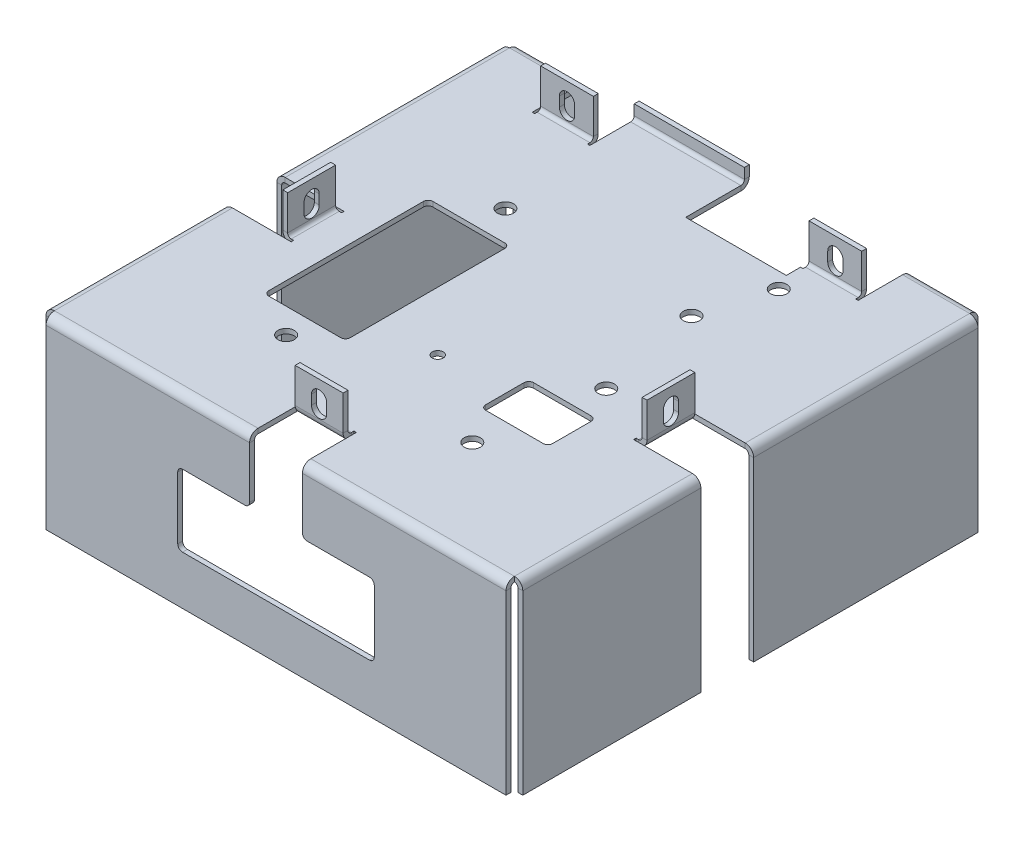
from build123d import *

# Parameters (mm, degrees)
SKETCH1_W                     = 96
SKETCH1_H                     = 96.75
BASE_FLANGE1_DEPTH            = 1.016
EDGE_FLANGE1_STRIP_W          = 12.5372
EDGE_FLANGE1_STRIP_H          = 1.016
EDGE_FLANGE1_STRIP_CUT_DEPTH  = 11
EDGE_FLANGE1_RELIEF_W         = 13.0452
EDGE_FLANGE1_RELIEF_H         = 0.508
EDGE_FLANGE1_RELIEF_CUT_DEPTH = 1.016
EDGE_FLANGE1_DEPTH            = 11
CUT_EXTRUDE4_REACH            = 104.093
EDGE_FLANGE8_STRIP_W          = 14.5372
EDGE_FLANGE8_STRIP_H          = 1.016
EDGE_FLANGE8_STRIP_CUT_DEPTH  = 10
EDGE_FLANGE8_RELIEF_W         = 15.0452
EDGE_FLANGE8_RELIEF_H         = 0.508
EDGE_FLANGE8_RELIEF_CUT_DEPTH = 1.016
EDGE_FLANGE8_DEPTH            = 10
EDGE_FLANGE2_STRIP_W          = 5.5372
EDGE_FLANGE2_STRIP_H          = 1.016
EDGE_FLANGE2_STRIP_CUT_DEPTH  = 42.492
EDGE_FLANGE2_DEPTH            = 42.492
EDGE_FLANGE9_STRIP_W          = 5.5372
EDGE_FLANGE9_STRIP_H          = 1.016
EDGE_FLANGE9_STRIP_CUT_DEPTH  = 42.492
EDGE_FLANGE9_DEPTH            = 42.492
EDGE_FLANGE4_STRIP_W          = 15.5372
EDGE_FLANGE4_STRIP_H          = 1.016
EDGE_FLANGE4_STRIP_CUT_DEPTH  = 10
EDGE_FLANGE4_RELIEF_W         = 16.0452
EDGE_FLANGE4_RELIEF_H         = 0.508
EDGE_FLANGE4_RELIEF_CUT_DEPTH = 1.016
EDGE_FLANGE4_DEPTH            = 10
CUT_EXTRUDE1_REACH            = 107.99
EDGE_FLANGE5_DEPTH            = 37.155701425
EDGE_FLANGE6_DEPTH            = 46.825698575
CUT_EXTRUDE2_REACH            = 110.042
EDGE_FLANGE10_DEPTH           = 13.992
SKETCH59_W                    = 20.992
SKETCH59_H                    = 12.25
CUT_EXTRUDE9_DEPTH            = 10
EDGE_FLANGE11_STRIP_W         = 5.5372
EDGE_FLANGE11_STRIP_H         = 1.016
EDGE_FLANGE11_STRIP_CUT_DEPTH = 22.992
EDGE_FLANGE11_DEPTH           = 22.992
CUT_EXTRUDE5_REACH            = 82.534
SKETCH54_W                    = 17
SKETCH54_H                    = 34.2448
CUT_EXTRUDE6_REACH            = 82.534
SKETCH55_W                    = 14
SKETCH55_H                    = 10
CUT_EXTRUDE7_REACH            = 82.534
SKETCH56_R                    = 1.7
CUT_EXTRUDE8_REACH            = 118.943
SKETCH57_W                    = 15
SKETCH57_H                    = 15
FILLET1_R                     = 1
CUT_EXTRUDE10_REACH           = 82.534
SKETCH60_R                    = 1.1303
BOSS_EXTRUDE1_REACH           = 86.049
SKETCH61_W                    = 1.016
SKETCH61_H                    = 10.18


# Sheet-metal steps are written as plain solids
with BuildPart() as part:
    # Sketch1 → Base-Flange1 (new body)
    with BuildSketch(Plane(origin=(0, 0, 0), x_dir=(1, 0, 0), z_dir=(0, 1, 0))):
        Rectangle(SKETCH1_W, SKETCH1_H)
    extrude(amount=-BASE_FLANGE1_DEPTH)

    # Edge-Flange1 strip (across the edge) → Edge-Flange1 strip cut (cut)
    with BuildSketch(Plane(origin=(33.5, 0, -41.375), x_dir=(0, 0, 1), z_dir=(-1, 0, 0))):
        with Locations((-4.516, -0.508)):
            Rectangle(EDGE_FLANGE1_STRIP_W, EDGE_FLANGE1_STRIP_H)
    edge_flange1_strip_cut = extrude(amount=EDGE_FLANGE1_STRIP_CUT_DEPTH, mode=Mode.SUBTRACT)

    # Edge-Flange1 relief (on the sheet) → Edge-Flange1 relief cut (cut)
    with BuildSketch(Plane(origin=(33.5, 0, -39.6224), x_dir=(0, 0, 1), z_dir=(0, 1, 0))):
        with Locations((-6.0146, 0.254)):
            Rectangle(EDGE_FLANGE1_RELIEF_W, EDGE_FLANGE1_RELIEF_H)
        with Locations((-6.0146, -11.254)):
            Rectangle(EDGE_FLANGE1_RELIEF_W, EDGE_FLANGE1_RELIEF_H)
    edge_flange1_relief_cut = extrude(amount=-EDGE_FLANGE1_RELIEF_CUT_DEPTH, mode=Mode.SUBTRACT)

    # Edge-Flange1 section (across the edge) → Edge-Flange1 (add)
    with BuildSketch(Plane(origin=(33.5, 0, -41.375), x_dir=(0, 0, 1), z_dir=(-1, 0, 0))):
        with BuildLine():
            Line((0, 0.7366), (0, 8))
            Line((0, 8), (1.016, 8))
            Line((1.016, 8), (1.016, 0.7366))
            ThreePointArc((1.016, 0.7366), (1.231745145, 0.215745145), (1.7526, 0))
            Line((1.7526, 0), (1.7526, -1.016))
            ThreePointArc((1.7526, -1.016), (0.513324655, -0.502675345), (0, 0.7366))
        make_face()
    edge_flange1 = extrude(amount=EDGE_FLANGE1_DEPTH)

    # Sketch47 → Cut-Extrude4 (cut, up to next)
    with BuildSketch(Plane(origin=(0, 0, -41.375), x_dir=(-1, 0, 0), z_dir=(0, 0, -1)), mode=Mode.PRIVATE) as cut_extrude4_sk1:
        with BuildLine():
            Line((-29.59, 4.5), (-29.59, 2.5))
            ThreePointArc((-29.59, 2.5), (-28, 0.91), (-26.41, 2.5))
            Line((-26.41, 2.5), (-26.41, 4.5))
            ThreePointArc((-26.41, 4.5), (-28, 6.09), (-29.59, 4.5))
        make_face()
    cut_extrude4_tool1 = extrude(cut_extrude4_sk1.sketch, amount=-CUT_EXTRUDE4_REACH, mode=Mode.PRIVATE) & part.part
    cut_extrude4 = cut_extrude4_tool1.solids().sort_by_distance((28, 3.5, -41.375))[0]
    add(cut_extrude4, mode=Mode.SUBTRACT)

    # Mirror4: Edge-Flange1 strip cut, Edge-Flange1 relief cut, Edge-Flange1, Cut-Extrude4 across plane
    add(edge_flange1_strip_cut.mirror(Plane(origin=(0, 0, 0), x_dir=(0, 0, 1), z_dir=(1, 0, 0))), mode=Mode.SUBTRACT)
    add(edge_flange1_relief_cut.mirror(Plane(origin=(0, 0, 0), x_dir=(0, 0, 1), z_dir=(1, 0, 0))), mode=Mode.SUBTRACT)
    add(edge_flange1.mirror(Plane(origin=(0, 0, 0), x_dir=(0, 0, 1), z_dir=(1, 0, 0))))
    add(cut_extrude4.mirror(Plane(origin=(0, 0, 0), x_dir=(0, 0, 1), z_dir=(1, 0, 0))), mode=Mode.SUBTRACT)

    # Edge-Flange8 strip (across the edge) → Edge-Flange8 strip cut (cut)
    with BuildSketch(Plane(origin=(-5, 0, 39.375), x_dir=(0, 0, -1), z_dir=(1, 0, 0))):
        with Locations((-5.516, -0.508)):
            Rectangle(EDGE_FLANGE8_STRIP_W, EDGE_FLANGE8_STRIP_H)
    extrude(amount=EDGE_FLANGE8_STRIP_CUT_DEPTH, mode=Mode.SUBTRACT)

    # Edge-Flange8 relief (on the sheet) → Edge-Flange8 relief cut (cut)
    with BuildSketch(Plane(origin=(-5, 0, 37.6224), x_dir=(0, 0, -1), z_dir=(0, 1, 0))):
        with Locations((-7.0146, 0.254)):
            Rectangle(EDGE_FLANGE8_RELIEF_W, EDGE_FLANGE8_RELIEF_H)
        with Locations((-7.0146, -10.254)):
            Rectangle(EDGE_FLANGE8_RELIEF_W, EDGE_FLANGE8_RELIEF_H)
    extrude(amount=-EDGE_FLANGE8_RELIEF_CUT_DEPTH, mode=Mode.SUBTRACT)

    # Edge-Flange8 section (across the edge) → Edge-Flange8 (add)
    with BuildSketch(Plane(origin=(-5, 0, 39.375), x_dir=(0, 0, -1), z_dir=(1, 0, 0))):
        with BuildLine():
            Line((0, 0.7366), (0, 8))
            Line((0, 8), (1.016, 8))
            Line((1.016, 8), (1.016, 0.7366))
            ThreePointArc((1.016, 0.7366), (1.231745145, 0.215745145), (1.7526, 0))
            Line((1.7526, 0), (1.7526, -1.016))
            ThreePointArc((1.7526, -1.016), (0.513324655, -0.502675345), (0, 0.7366))
        make_face()
    extrude(amount=EDGE_FLANGE8_DEPTH)

    # Edge-Flange2 strip (across the edge) → Edge-Flange2 strip cut (cut)
    with BuildSketch(Plane(origin=(-5.508, -1.016, 48.375), x_dir=(0, 0, -1), z_dir=(-1, 0, 0))):
        with Locations((-1.016, -0.508)):
            Rectangle(EDGE_FLANGE2_STRIP_W, EDGE_FLANGE2_STRIP_H)
    extrude(amount=EDGE_FLANGE2_STRIP_CUT_DEPTH, mode=Mode.SUBTRACT)

    # Edge-Flange2 section (across the edge) → Edge-Flange2 (add)
    with BuildSketch(Plane(origin=(-5.508, -1.016, 48.375), x_dir=(0, 0, -1), z_dir=(-1, 0, 0))):
        with BuildLine():
            Line((0, 0.7366), (0, 37.684))
            Line((0, 37.684), (1.016, 37.684))
            Line((1.016, 37.684), (1.016, 0.7366))
            ThreePointArc((1.016, 0.7366), (1.231745145, 0.215745145), (1.7526, 0))
            Line((1.7526, 0), (1.7526, -1.016))
            ThreePointArc((1.7526, -1.016), (0.513324655, -0.502675345), (0, 0.7366))
        make_face()
    extrude(amount=EDGE_FLANGE2_DEPTH)

    # Edge-Flange9 strip (across the edge) → Edge-Flange9 strip cut (cut)
    with BuildSketch(Plane(origin=(48, -1.016, 48.375), x_dir=(0, 0, -1), z_dir=(-1, 0, 0))):
        with Locations((-1.016, -0.508)):
            Rectangle(EDGE_FLANGE9_STRIP_W, EDGE_FLANGE9_STRIP_H)
    extrude(amount=EDGE_FLANGE9_STRIP_CUT_DEPTH, mode=Mode.SUBTRACT)

    # Edge-Flange9 section (across the edge) → Edge-Flange9 (add)
    with BuildSketch(Plane(origin=(48, -1.016, 48.375), x_dir=(0, 0, -1), z_dir=(-1, 0, 0))):
        with BuildLine():
            Line((0, 0.7366), (0, 37.684))
            Line((0, 37.684), (1.016, 37.684))
            Line((1.016, 37.684), (1.016, 0.7366))
            ThreePointArc((1.016, 0.7366), (1.231745145, 0.215745145), (1.7526, 0))
            Line((1.7526, 0), (1.7526, -1.016))
            ThreePointArc((1.7526, -1.016), (0.513324655, -0.502675345), (0, 0.7366))
        make_face()
    extrude(amount=EDGE_FLANGE9_DEPTH)

    # Edge-Flange4 strip (across the edge) → Edge-Flange4 strip cut (cut)
    with BuildSketch(Plane(origin=(-38, 0, -1.041301425), x_dir=(1, 0, 0), z_dir=(0, 0, 1))):
        with Locations((-6.016, -0.508)):
            Rectangle(EDGE_FLANGE4_STRIP_W, EDGE_FLANGE4_STRIP_H)
    edge_flange4_strip_cut = extrude(amount=EDGE_FLANGE4_STRIP_CUT_DEPTH, mode=Mode.SUBTRACT)

    # Edge-Flange4 relief (on the sheet) → Edge-Flange4 relief cut (cut)
    with BuildSketch(Plane(origin=(-36.2474, 0, -1.041301425), x_dir=(1, 0, 0), z_dir=(0, 1, 0))):
        with Locations((-7.5146, 0.254)):
            Rectangle(EDGE_FLANGE4_RELIEF_W, EDGE_FLANGE4_RELIEF_H)
        with Locations((-7.5146, -10.254)):
            Rectangle(EDGE_FLANGE4_RELIEF_W, EDGE_FLANGE4_RELIEF_H)
    edge_flange4_relief_cut = extrude(amount=-EDGE_FLANGE4_RELIEF_CUT_DEPTH, mode=Mode.SUBTRACT)

    # Edge-Flange4 section (across the edge) → Edge-Flange4 (add)
    with BuildSketch(Plane(origin=(-38, 0, -1.041301425), x_dir=(1, 0, 0), z_dir=(0, 0, 1))):
        with BuildLine():
            Line((0, 0.7366), (0, 8))
            Line((0, 8), (1.016, 8))
            Line((1.016, 8), (1.016, 0.7366))
            ThreePointArc((1.016, 0.7366), (1.231745145, 0.215745145), (1.7526, 0))
            Line((1.7526, 0), (1.7526, -1.016))
            ThreePointArc((1.7526, -1.016), (0.513324655, -0.502675345), (0, 0.7366))
        make_face()
    edge_flange4 = extrude(amount=EDGE_FLANGE4_DEPTH)

    # Sketch24 → Cut-Extrude1 (cut, up to next)
    with BuildSketch(Plane.ZY.offset(38), mode=Mode.PRIVATE) as cut_extrude1_sk1:
        with BuildLine():
            Line((2.368698575, 4.5), (2.368698575, 2.5))
            ThreePointArc((2.368698575, 2.5), (3.958698575, 0.91), (5.548698575, 2.5))
            Line((5.548698575, 2.5), (5.548698575, 4.5))
            ThreePointArc((5.548698575, 4.5), (3.958698575, 6.09), (2.368698575, 4.5))
        make_face()
    cut_extrude1_tool1 = extrude(cut_extrude1_sk1.sketch, amount=-CUT_EXTRUDE1_REACH, mode=Mode.PRIVATE) & part.part
    cut_extrude1 = cut_extrude1_tool1.solids().sort_by_distance((-38, 3.5, 3.958699))[0]
    add(cut_extrude1, mode=Mode.SUBTRACT)

    # Mirror5: Edge-Flange4 strip cut, Edge-Flange4 relief cut, Edge-Flange4, Cut-Extrude1 across plane
    add(edge_flange4_strip_cut.mirror(Plane(origin=(0, 0, 0), x_dir=(0, 0, 1), z_dir=(1, 0, 0))), mode=Mode.SUBTRACT)
    add(edge_flange4_relief_cut.mirror(Plane(origin=(0, 0, 0), x_dir=(0, 0, 1), z_dir=(1, 0, 0))), mode=Mode.SUBTRACT)
    add(edge_flange4.mirror(Plane(origin=(0, 0, 0), x_dir=(0, 0, 1), z_dir=(1, 0, 0))))
    add(cut_extrude1.mirror(Plane(origin=(0, 0, 0), x_dir=(0, 0, 1), z_dir=(1, 0, 0))), mode=Mode.SUBTRACT)

    # Edge-Flange5 section (across the edge) → Edge-Flange5 (add)
    with BuildSketch(Plane(origin=(-48.7366, -1.016, 46.6224), x_dir=(1, 0, 0), z_dir=(0, 0, -1))):
        with BuildLine():
            Line((-1.016, 0.7366), (-1.016, 37.684))
            Line((-1.016, 37.684), (0, 37.684))
            Line((0, 37.684), (0, 0.7366))
            ThreePointArc((0, 0.7366), (0.215745145, 0.215745145), (0.7366, 0))
            Line((0.7366, 0), (0.7366, -1.016))
            ThreePointArc((0.7366, -1.016), (-0.502675345, -0.502675345), (-1.016, 0.7366))
        make_face()
    edge_flange5 = extrude(amount=EDGE_FLANGE5_DEPTH)

    # Edge-Flange6 section (across the edge) → Edge-Flange6 (add)
    with BuildSketch(Plane(origin=(-48.7366, -1.016, -1.549301425), x_dir=(1, 0, 0), z_dir=(0, 0, -1))):
        with BuildLine():
            Line((-1.016, 0.7366), (-1.016, 37.684))
            Line((-1.016, 37.684), (0, 37.684))
            Line((0, 37.684), (0, 0.7366))
            ThreePointArc((0, 0.7366), (0.215745145, 0.215745145), (0.7366, 0))
            Line((0.7366, 0), (0.7366, -1.016))
            ThreePointArc((0.7366, -1.016), (-0.502675345, -0.502675345), (-1.016, 0.7366))
        make_face()
    edge_flange6 = extrude(amount=EDGE_FLANGE6_DEPTH)

    # Mirror6: Edge-Flange5, Edge-Flange6 across plane
    add(edge_flange5.mirror(Plane(origin=(0, 0, 0), x_dir=(0, 0, 1), z_dir=(1, 0, 0))))
    add(edge_flange6.mirror(Plane(origin=(0, 0, 0), x_dir=(0, 0, 1), z_dir=(1, 0, 0))))

    # Sketch44 → Cut-Extrude2 (cut, up to next)
    with BuildSketch(Plane.XY.offset(39.375), mode=Mode.PRIVATE) as cut_extrude2_sk1:
        with BuildLine():
            Line((-1.59, 4.5), (-1.59, 2.5))
            ThreePointArc((-1.59, 2.5), (0, 0.91), (1.59, 2.5))
            Line((1.59, 2.5), (1.59, 4.5))
            ThreePointArc((1.59, 4.5), (0, 6.09), (-1.59, 4.5))
        make_face()
    cut_extrude2_tool1 = extrude(cut_extrude2_sk1.sketch, amount=-CUT_EXTRUDE2_REACH, mode=Mode.PRIVATE) & part.part
    add(cut_extrude2_tool1.solids().sort_by_distance((0, 3.5, 39.375))[0], mode=Mode.SUBTRACT)

    # Edge-Flange10 section (across the edge) → Edge-Flange10 (add)
    with BuildSketch(Plane(origin=(34.008, -1.016, -49.1116), x_dir=(0, 0, 1), z_dir=(1, 0, 0))):
        with BuildLine():
            Line((-1.016, 0.7366), (-1.016, 37.684))
            Line((-1.016, 37.684), (0, 37.684))
            Line((0, 37.684), (0, 0.7366))
            ThreePointArc((0, 0.7366), (0.215745145, 0.215745145), (0.7366, 0))
            Line((0.7366, 0), (0.7366, -1.016))
            ThreePointArc((0.7366, -1.016), (-0.502675345, -0.502675345), (-1.016, 0.7366))
        make_face()
    edge_flange10 = extrude(amount=EDGE_FLANGE10_DEPTH)

    # Mirror7: Edge-Flange10 across plane
    add(edge_flange10.mirror(Plane(origin=(0, 0, 0), x_dir=(0, 0, 1), z_dir=(1, 0, 0))))

    # Sketch59 → Cut-Extrude9 (cut)
    with BuildSketch(Plane(origin=(0, 0, 0), x_dir=(1, 0, 0), z_dir=(0, 1, 0))):
        with Locations((11.496, 42.25)):
            Rectangle(SKETCH59_W, SKETCH59_H)
    extrude(amount=-CUT_EXTRUDE9_DEPTH, mode=Mode.SUBTRACT)

    # Edge-Flange11 strip (across the edge) → Edge-Flange11 strip cut (cut)
    with BuildSketch(Plane(origin=(1, 0, -48.375), x_dir=(0, 0, 1), z_dir=(-1, 0, 0))):
        with Locations((-2.032, -0.508)):
            Rectangle(EDGE_FLANGE11_STRIP_W, EDGE_FLANGE11_STRIP_H)
    extrude(amount=EDGE_FLANGE11_STRIP_CUT_DEPTH, mode=Mode.SUBTRACT)

    # Edge-Flange11 section (across the edge) → Edge-Flange11 (add)
    with BuildSketch(Plane(origin=(1, 0, -48.375), x_dir=(0, 0, 1), z_dir=(-1, 0, 0))):
        with BuildLine():
            Line((-1.016, 0.7366), (-1.016, 2.894))
            Line((-1.016, 2.894), (0, 2.894))
            Line((0, 2.894), (0, 0.7366))
            ThreePointArc((0, 0.7366), (0.215745145, 0.215745145), (0.7366, 0))
            Line((0.7366, 0), (0.7366, -1.016))
            ThreePointArc((0.7366, -1.016), (-0.502675345, -0.502675345), (-1.016, 0.7366))
        make_face()
    extrude(amount=EDGE_FLANGE11_DEPTH)

    # Sketch54 → Cut-Extrude5 (cut, up to next)
    with BuildSketch(Plane(origin=(0, 0, 0), x_dir=(1, 0, 0), z_dir=(0, 1, 0)), mode=Mode.PRIVATE) as cut_extrude5_sk1:
        with Locations((-20.7474, -4.5)):
            Rectangle(SKETCH54_W, SKETCH54_H)
    cut_extrude5_tool1 = extrude(cut_extrude5_sk1.sketch, amount=-CUT_EXTRUDE5_REACH, mode=Mode.PRIVATE) & part.part
    add(cut_extrude5_tool1.solids().sort_by_distance((-20.7474, 0, 4.5))[0], mode=Mode.SUBTRACT)

    # Sketch55 → Cut-Extrude6 (cut, up to next)
    with BuildSketch(Plane(origin=(0, 0, 0), x_dir=(1, 0, 0), z_dir=(0, 1, 0)), mode=Mode.PRIVATE) as cut_extrude6_sk1:
        with Locations((21, -14.6224)):
            Rectangle(SKETCH55_W, SKETCH55_H)
    cut_extrude6_tool1 = extrude(cut_extrude6_sk1.sketch, amount=-CUT_EXTRUDE6_REACH, mode=Mode.PRIVATE) & part.part
    add(cut_extrude6_tool1.solids().sort_by_distance((21, 0, 14.6224))[0], mode=Mode.SUBTRACT)

    # Sketch56 → Cut-Extrude7 (cut, up to next)
    with BuildSketch(Plane(origin=(0, 0, 0), x_dir=(1, 0, 0), z_dir=(0, 1, 0)), mode=Mode.PRIVATE) as cut_extrude7_sk1:
        with Locations(Location((-19.42, 18.915, 0), (0, 0, 270))):
            Circle(SKETCH56_R)
    cut_extrude7_tool1 = extrude(cut_extrude7_sk1.sketch, amount=-CUT_EXTRUDE7_REACH, mode=Mode.PRIVATE) & part.part
    # Sketch56 → Cut-Extrude7 (cut, up to next)
    with BuildSketch(Plane(origin=(0, 0, 0), x_dir=(1, 0, 0), z_dir=(0, 1, 0)), mode=Mode.PRIVATE) as cut_extrude7_sk2:
        with Locations(Location((19.42, 18.915, 0), (0, 0, 270))):
            Circle(SKETCH56_R)
    cut_extrude7_tool2 = extrude(cut_extrude7_sk2.sketch, amount=-CUT_EXTRUDE7_REACH, mode=Mode.PRIVATE) & part.part
    # Sketch56 → Cut-Extrude7 (cut, up to next)
    with BuildSketch(Plane(origin=(0, 0, 0), x_dir=(1, 0, 0), z_dir=(0, 1, 0)), mode=Mode.PRIVATE) as cut_extrude7_sk3:
        with Locations(Location((-19.42, -26.8324, 0), (0, 0, 270))):
            Circle(SKETCH56_R)
    cut_extrude7_tool3 = extrude(cut_extrude7_sk3.sketch, amount=-CUT_EXTRUDE7_REACH, mode=Mode.PRIVATE) & part.part
    # Sketch56 → Cut-Extrude7 (cut, up to next)
    with BuildSketch(Plane(origin=(0, 0, 0), x_dir=(1, 0, 0), z_dir=(0, 1, 0)), mode=Mode.PRIVATE) as cut_extrude7_sk4:
        with Locations(Location((19.42, -26.8324, 0), (0, 0, 270))):
            Circle(SKETCH56_R)
    cut_extrude7_tool4 = extrude(cut_extrude7_sk4.sketch, amount=-CUT_EXTRUDE7_REACH, mode=Mode.PRIVATE) & part.part
    # Sketch56 → Cut-Extrude7 (cut, up to next)
    with BuildSketch(Plane(origin=(0, 0, 0), x_dir=(1, 0, 0), z_dir=(0, 1, 0)), mode=Mode.PRIVATE) as cut_extrude7_sk5:
        with Locations(Location((23.67, 32.875, 0), (0, 0, 270))):
            Circle(SKETCH56_R)
    cut_extrude7_tool5 = extrude(cut_extrude7_sk5.sketch, amount=-CUT_EXTRUDE7_REACH, mode=Mode.PRIVATE) & part.part
    # Sketch56 → Cut-Extrude7 (cut, up to next)
    with BuildSketch(Plane(origin=(0, 0, 0), x_dir=(1, 0, 0), z_dir=(0, 1, 0)), mode=Mode.PRIVATE) as cut_extrude7_sk6:
        with Locations(Location((23.67, -3.125, 0), (0, 0, 270))):
            Circle(SKETCH56_R)
    cut_extrude7_tool6 = extrude(cut_extrude7_sk6.sketch, amount=-CUT_EXTRUDE7_REACH, mode=Mode.PRIVATE) & part.part
    add(cut_extrude7_tool1.solids().sort_by_distance((-19.42, 0, -18.915))[0], mode=Mode.SUBTRACT)
    add(cut_extrude7_tool2.solids().sort_by_distance((19.42, 0, -18.915))[0], mode=Mode.SUBTRACT)
    add(cut_extrude7_tool3.solids().sort_by_distance((-19.42, 0, 26.8324))[0], mode=Mode.SUBTRACT)
    add(cut_extrude7_tool4.solids().sort_by_distance((19.42, 0, 26.8324))[0], mode=Mode.SUBTRACT)
    add(cut_extrude7_tool5.solids().sort_by_distance((23.67, 0, -32.875))[0], mode=Mode.SUBTRACT)
    add(cut_extrude7_tool6.solids().sort_by_distance((23.67, 0, 3.125))[0], mode=Mode.SUBTRACT)

    # Sketch57 → Cut-Extrude8 (cut, up to next)
    with BuildSketch(Plane.XY.offset(48.375), mode=Mode.PRIVATE) as cut_extrude8_sk1:
        with Locations((-13.008, -21.02)):
            Rectangle(SKETCH57_W, SKETCH57_H)
    cut_extrude8_tool1 = extrude(cut_extrude8_sk1.sketch, amount=-CUT_EXTRUDE8_REACH, mode=Mode.PRIVATE) & part.part
    cut_extrude8 = cut_extrude8_tool1.solids().sort_by_distance((-13.008, -21.02, 48.375))[0]
    add(cut_extrude8, mode=Mode.SUBTRACT)

    # Mirror8: Cut-Extrude8 across plane
    add(cut_extrude8.mirror(Plane(origin=(0, 0, 0), x_dir=(0, 0, 1), z_dir=(1, 0, 0))), mode=Mode.SUBTRACT)

    # Fillet1
    fillet1_edges = [part.edges().sort_by_distance(p)[0] for p in [
        (-29.2474, -0.508, 21.6224),
        (-29.2474, -0.508, -12.6224),
        (-12.2474, -0.508, -12.6224),
        (-12.2474, -0.508, 21.6224),
        (28, -0.508, 9.6224),
        (28, -0.508, 19.6224),
        (14, -0.508, 19.6224),
        (14, -0.508, 9.6224),
        (-5.508, -13.52, 47.867),
        (-20.508, -28.52, 47.867),
        (-20.508, -13.52, 47.867),
        (5.508, -13.52, 47.867),
        (20.508, -13.52, 47.867),
        (20.508, -28.52, 47.867),
    ]]
    fillet(fillet1_edges, radius=FILLET1_R)

    # Sketch60 → Cut-Extrude10 (cut, up to next)
    with BuildSketch(Plane(origin=(0, 0, 0), x_dir=(1, 0, 0), z_dir=(0, 1, 0)), mode=Mode.PRIVATE) as cut_extrude10_sk1:
        with Locations(Location((0, -14.6224, 0), (0, 0, 270))):
            Circle(SKETCH60_R)
    cut_extrude10_tool1 = extrude(cut_extrude10_sk1.sketch, amount=-CUT_EXTRUDE10_REACH, mode=Mode.PRIVATE) & part.part
    add(cut_extrude10_tool1.solids().sort_by_distance((0, 0, 14.6224))[0], mode=Mode.SUBTRACT)

    # Sketch61 → Boss-Extrude1 (add, up to next)
    with BuildSketch(Plane(origin=(-5.508, 0, 0), x_dir=(0, 0, -1), z_dir=(1, 0, 0)), mode=Mode.PRIVATE) as boss_extrude1_sk1:
        with Locations((-47.867, -33.61)):
            Rectangle(SKETCH61_W, SKETCH61_H)
    boss_extrude1_tool1 = extrude(boss_extrude1_sk1.sketch, amount=BOSS_EXTRUDE1_REACH, mode=Mode.PRIVATE) - part.part
    add(boss_extrude1_tool1.solids().sort_by_distance((-5.508, -33.61, 47.867))[0])


solid = part.part
